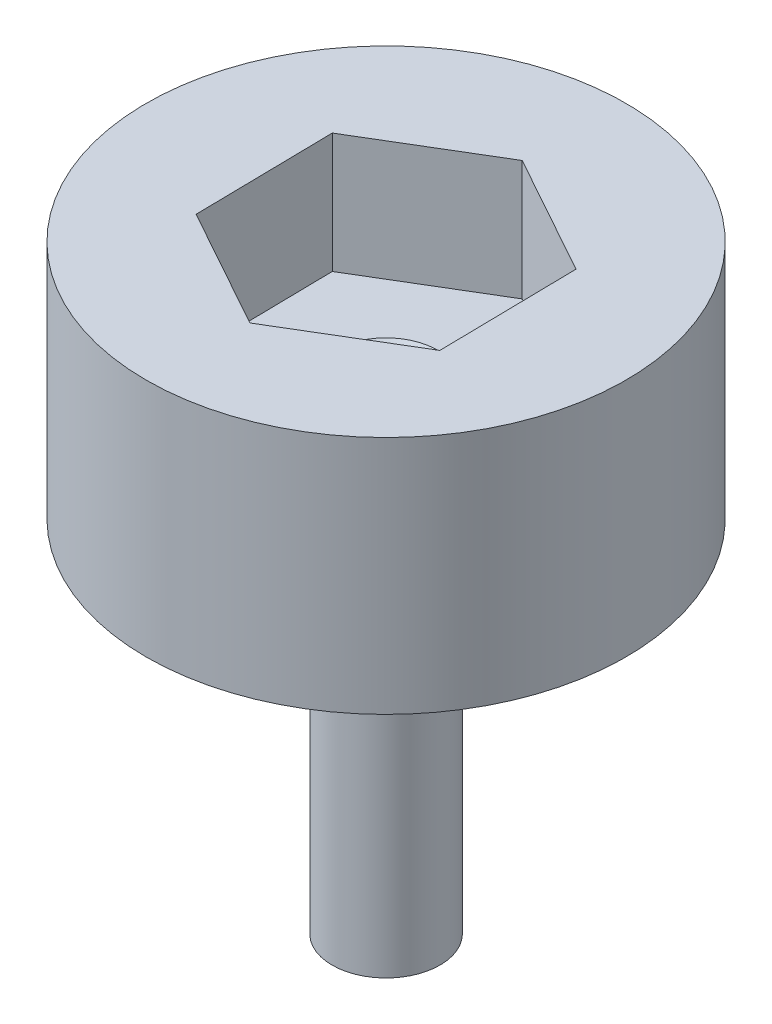
from build123d import *

# Parameters (mm, degrees)
SKETCH2_R                       = 20
BOSS_EXTRUDE3_DEPTH             = 20
CUT_EXTRUDE1_DEPTH              = 10
SKETCH6_R                       = 4.5
BOSS_EXTRUDE5_DEPTH             = 40
M8X1_0_TAPPED_HOLE1_D           = 7
M8X1_0_TAPPED_HOLE1_CSINK_D     = 8.65
M8X1_0_TAPPED_HOLE1_CSINK_ANGLE = 90
THREAD8_PITCH                   = 1


with BuildPart() as part:
    # Sketch2 → Boss-Extrude3 (new body)
    with BuildSketch(Plane(origin=(0, 0, 0), x_dir=(1, 0, 0), z_dir=(0, 1, 0))):
        with Locations(Location((0, 0, 0), (0, 0, 270))):
            Circle(SKETCH2_R)
    extrude(amount=BOSS_EXTRUDE3_DEPTH)

    # Sketch5 → Cut-Extrude1 (cut)
    with BuildSketch(Plane(origin=(0, 20, 0), x_dir=(1, 0, 0), z_dir=(0, 1, 0))):
        Polygon((10.093898774, -5.607721541), (9.903378699, 5.937711991), (-0.190520075, 11.545433532), (-10.093898774, 5.607721541), (-9.903378699, -5.937711991), (0.190520075, -11.545433532), align=None)
    extrude(amount=-CUT_EXTRUDE1_DEPTH, mode=Mode.SUBTRACT)

    # Sketch6 → Boss-Extrude5 (add)
    with BuildSketch(Plane(origin=(0, 10, 0), x_dir=(1, 0, 0), z_dir=(0, 1, 0))):
        with Locations(Location((0, 0, 0), (0, 0, 270))):
            Circle(SKETCH6_R)
    extrude(amount=-BOSS_EXTRUDE5_DEPTH)

    # M8x1.0 Tapped Hole1 (through all)
    with Locations(Plane(origin=(0, 10, 0), x_dir=(1, 0, 0), z_dir=(0, 1, 0))):
        with Locations((0, 0)):
            CounterSinkHole(M8X1_0_TAPPED_HOLE1_D / 2, M8X1_0_TAPPED_HOLE1_CSINK_D / 2, counter_sink_angle=M8X1_0_TAPPED_HOLE1_CSINK_ANGLE)

    # Thread8: arcs per turn and ends read off the stored shape
    # Thread8: the profile of Thread Profile10 profile screwed along a right-hand helix through 37.175 turns, 8 arcs to a turn; built about Z, then put on its axis
    thread8_z = Axis((0, 0, 0), (0, 0, 1))
    thread8_corners = [(3.5003, 1e-09, -0.000173205), (3.5003, 1e-09, 0.875173202), (2.958734125, 1e-09, 0.562499999), (2.958734125, 1e-09, 0.312499999)]
    with BuildLine(mode=Mode.PRIVATE) as thread8_profile:
        Line(thread8_corners[0], thread8_corners[1])
        Line(thread8_corners[1], thread8_corners[2])
        Line(thread8_corners[2], thread8_corners[3])
        Line(thread8_corners[3], thread8_corners[0])
    thread8_cap = Face(thread8_profile.wire())
    thread8_turn_angles = [0, 22.5, 45, 67.5, 90, 112.5, 135, 157.5, 180, 202.5, 225, 247.5, 270, 292.5, 315, 337.5, 360]
    thread8_turn_weights = [1, 0.9238795325112867, 1, 0.9238795325112867, 1, 0.9238795325112867, 1, 0.9238795325112867, 1, 0.9238795325112867, 1, 0.9238795325112867, 1, 0.9238795325112867, 1, 0.9238795325112867, 1]
    thread8_turn_rails = [Edge.make_bspline([Vector(p[0], p[1], 0).rotate(thread8_z, thread8_turn_angles[k]) / thread8_turn_weights[k] + Vector(0, 0, p[2] + THREAD8_PITCH * thread8_turn_angles[k] / 360) for k in range(17)], [0, 0, 0, 1, 1, 2, 2, 3, 3, 4, 4, 5, 5, 6, 6, 7, 7, 8, 8, 8], 2, thread8_turn_weights) for p in thread8_corners]
    thread8_turn_sides = [Face.make_surface_from_curves(thread8_turn_rails[p[0]], thread8_turn_rails[p[1]]) for p in [(0, 1), (1, 2), (2, 3), (3, 0)]]
    thread8_last_angles = [13320, 13342.5, 13365, 13374, 13383]
    thread8_last_weights = [1, 0.9238795325112867, 1, 0.9876883405951378, 1]
    thread8_last_rails = [Edge.make_bspline([Vector(p[0], p[1], 0).rotate(thread8_z, thread8_last_angles[k]) / thread8_last_weights[k] + Vector(0, 0, p[2] + THREAD8_PITCH * thread8_last_angles[k] / 360) for k in range(5)], [0, 0, 0, 1, 1, 2, 2, 2], 2, thread8_last_weights) for p in thread8_corners]
    thread8_last_sides = [Face.make_surface_from_curves(thread8_last_rails[p[0]], thread8_last_rails[p[1]]) for p in [(0, 1), (1, 2), (2, 3), (3, 0)]]
    thread8 = Plane(origin=(0, 8.175, 0), x_dir=(-0.939692621, 0, -0.342020143), z_dir=(0, -1, 0)) * Solid(Shell([*[p.moved(Location((0, 0, THREAD8_PITCH * i))) for i in range(37) for p in thread8_turn_sides], *thread8_last_sides, thread8_cap, thread8_cap.rotate(thread8_z, 13383).moved(Location((0, 0, THREAD8_PITCH * 13383 / 360)))]))
    add(thread8)


solid = part.part
